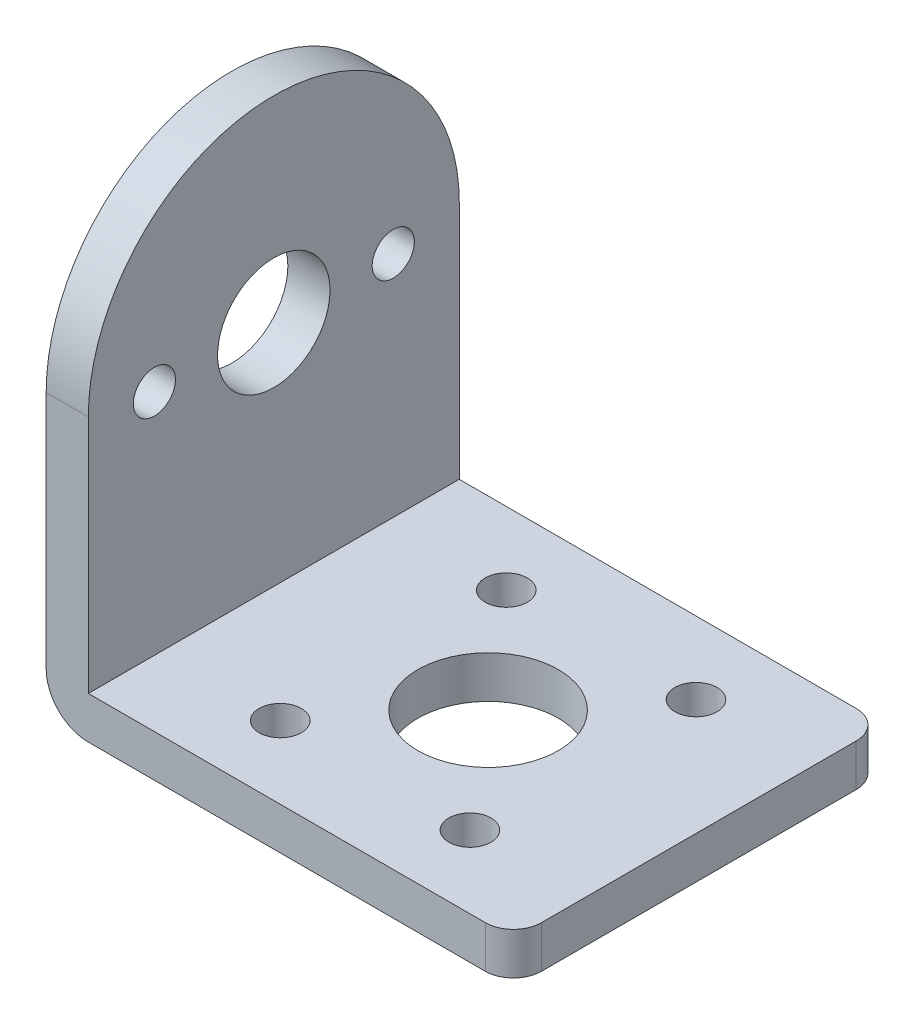
from build123d import *

# Parameters (mm, degrees)
SKETCH1_W               = 30.25
SKETCH1_H               = 26.4
BOSS_EXTRUDE1_DEPTH     = 3
SKETCH1_3_W             = 3
SKETCH1_3_H             = 26.4
BOSS_EXTRUDE2_DEPTH     = 33.25
FILLET1_R               = 3
CUT_EXTRUDE1_DEPTH      = 47.849386335
CUT_EXTRUDE1_DEPTH_BACK = 47.849386335
FILLET2_R               = 2
SKETCH3_R               = 4
SKETCH3_R_2             = 1.5
CUT_EXTRUDE2_DEPTH      = 47.849386335
CUT_EXTRUDE3_REACH      = 38.955
SKETCH4_R               = 5
SKETCH4_R_2             = 1.5


with BuildPart() as part:
    # Sketch1 → Boss-Extrude1 (new body)
    with BuildSketch(Plane(origin=(0, 0, 0), x_dir=(1, 0, 0), z_dir=(0, 1, 0))):
        with Locations((1.5, 0)):
            Rectangle(SKETCH1_W, SKETCH1_H)
    extrude(amount=BOSS_EXTRUDE1_DEPTH)

    # Sketch1<3> → Boss-Extrude2 (add)
    with BuildSketch(Plane(origin=(0, 0, 0), x_dir=(1, 0, 0), z_dir=(0, 1, 0))):
        with Locations((-15.125, 0)):
            Rectangle(SKETCH1_3_W, SKETCH1_3_H)
    extrude(amount=BOSS_EXTRUDE2_DEPTH)

    # Fillet1
    fillet1_edges = [part.edges().sort_by_distance(p)[0] for p in [
        (-16.625, 0, 0),
    ]]
    fillet(fillet1_edges, radius=FILLET1_R)

    # Sketch2 → Cut-Extrude1 (cut, two sides: drawn at the far end of the back side and taken through both)
    with BuildSketch(Plane(origin=(-13.625, 0, 0), x_dir=(0, 0, -1), z_dir=(1, 0, 0)).offset(-CUT_EXTRUDE1_DEPTH_BACK)):
        with BuildLine():
            Line((-13.2, 33.25), (-13.2, 20.05))
            ThreePointArc((-13.2, 20.05), (-9.333809512, 29.383809512), (0, 33.25))
            Line((0, 33.25), (-13.2, 33.25))
        make_face()
        with BuildLine():
            ThreePointArc((0, 33.25), (9.333809512, 29.383809512), (13.2, 20.05))
            Line((13.2, 20.05), (13.2, 33.25))
            Line((13.2, 33.25), (0, 33.25))
        make_face()
    extrude(amount=CUT_EXTRUDE1_DEPTH + CUT_EXTRUDE1_DEPTH_BACK, mode=Mode.SUBTRACT)

    # Fillet2
    fillet2_edges = [part.edges().sort_by_distance(p)[0] for p in [
        (16.625, 1.5, -13.2),
        (16.625, 1.5, 13.2),
    ]]
    fillet(fillet2_edges, radius=FILLET2_R)

    # Sketch3 → Cut-Extrude2 (cut, through all)
    with BuildSketch(Plane(origin=(-13.625, 0, 0), x_dir=(0, 0, -1), z_dir=(1, 0, 0))):
        with Locations((0, 19.25)):
            Circle(SKETCH3_R)
        with Locations((8.5, 19.25)):
            Circle(SKETCH3_R_2)
        with Locations((-8.5, 19.25)):
            Circle(SKETCH3_R_2)
    extrude(amount=-CUT_EXTRUDE2_DEPTH, mode=Mode.SUBTRACT)

    # Sketch4 → Cut-Extrude3 (cut, up to next)
    with BuildSketch(Plane(origin=(0, 3, 0), x_dir=(1, 0, 0), z_dir=(0, 1, 0)), mode=Mode.PRIVATE) as cut_extrude3_sk1:
        with Locations((1.625, 0)):
            Circle(SKETCH4_R)
    cut_extrude3_tool1 = extrude(cut_extrude3_sk1.sketch, amount=-CUT_EXTRUDE3_REACH, mode=Mode.PRIVATE) & part.part
    # Sketch4 → Cut-Extrude3 (cut, up to next)
    with BuildSketch(Plane(origin=(0, 3, 0), x_dir=(1, 0, 0), z_dir=(0, 1, 0)), mode=Mode.PRIVATE) as cut_extrude3_sk2:
        with Locations((-5.125, -8.042853971)):
            Circle(SKETCH4_R_2)
    cut_extrude3_tool2 = extrude(cut_extrude3_sk2.sketch, amount=-CUT_EXTRUDE3_REACH, mode=Mode.PRIVATE) & part.part
    # Sketch4 → Cut-Extrude3 (cut, up to next)
    with BuildSketch(Plane(origin=(0, 3, 0), x_dir=(1, 0, 0), z_dir=(0, 1, 0)), mode=Mode.PRIVATE) as cut_extrude3_sk3:
        with Locations((-5.125, 8.042853971)):
            Circle(SKETCH4_R_2)
    cut_extrude3_tool3 = extrude(cut_extrude3_sk3.sketch, amount=-CUT_EXTRUDE3_REACH, mode=Mode.PRIVATE) & part.part
    # Sketch4 → Cut-Extrude3 (cut, up to next)
    with BuildSketch(Plane(origin=(0, 3, 0), x_dir=(1, 0, 0), z_dir=(0, 1, 0)), mode=Mode.PRIVATE) as cut_extrude3_sk4:
        with Locations((8.375, -8.042853971)):
            Circle(SKETCH4_R_2)
    cut_extrude3_tool4 = extrude(cut_extrude3_sk4.sketch, amount=-CUT_EXTRUDE3_REACH, mode=Mode.PRIVATE) & part.part
    # Sketch4 → Cut-Extrude3 (cut, up to next)
    with BuildSketch(Plane(origin=(0, 3, 0), x_dir=(1, 0, 0), z_dir=(0, 1, 0)), mode=Mode.PRIVATE) as cut_extrude3_sk5:
        with Locations((8.375, 8.042853971)):
            Circle(SKETCH4_R_2)
    cut_extrude3_tool5 = extrude(cut_extrude3_sk5.sketch, amount=-CUT_EXTRUDE3_REACH, mode=Mode.PRIVATE) & part.part
    add(cut_extrude3_tool1.solids().sort_by_distance((1.625, 3, 0))[0], mode=Mode.SUBTRACT)
    add(cut_extrude3_tool2.solids().sort_by_distance((-5.125, 3, 8.042854))[0], mode=Mode.SUBTRACT)
    add(cut_extrude3_tool3.solids().sort_by_distance((-5.125, 3, -8.042854))[0], mode=Mode.SUBTRACT)
    add(cut_extrude3_tool4.solids().sort_by_distance((8.375, 3, 8.042854))[0], mode=Mode.SUBTRACT)
    add(cut_extrude3_tool5.solids().sort_by_distance((8.375, 3, -8.042854))[0], mode=Mode.SUBTRACT)


solid = part.part
